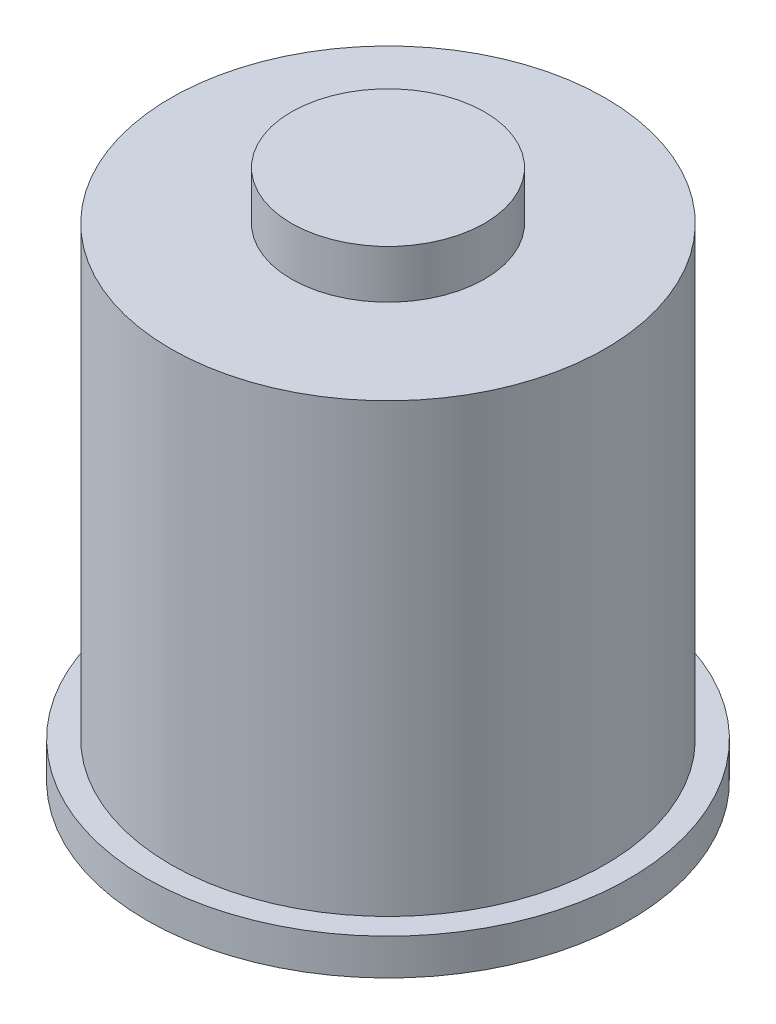
from build123d import *


with BuildPart() as part:
    # Esquisse1 → Révolution1 (revolve)
    with BuildSketch(Plane(origin=(0, 0, 0), x_dir=(0, 0, -1), z_dir=(1, 0, 0))):
        with BuildLine():
            Line((10, 0), (2.5, 0))
            ThreePointArc((2.5, 0), (1.767766953, -1.767766953), (0, -2.5))
            Line((0, -2.5), (0, 0))
            Line((0, 0), (0, 20))
            Line((0, 20), (0, 22))
            Line((0, 22), (4, 22))
            Line((4, 22), (4, 20))
            Line((4, 20), (9, 20))
            Line((9, 20), (9, 1.5))
            Line((9, 1.5), (10, 1.5))
            Line((10, 1.5), (10, 0))
        make_face()
    revolve(axis=Axis((0, 0, 0), (0, 1, 0)))


solid = part.part
